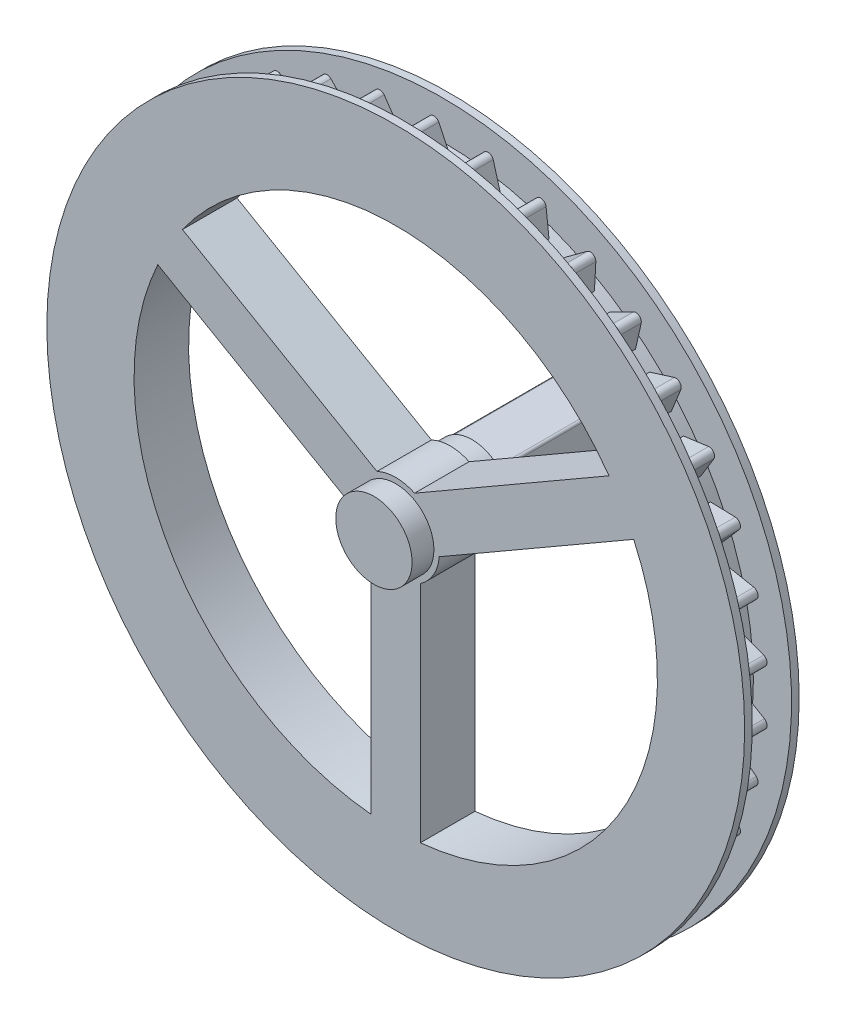
from build123d import *

# Parameters (mm, degrees)
SKETCH1_R                = 40
BOSS_EXTRUDE1_DEPTH      = 5
CUT_EXTRUDE1_DEPTH       = 5
SCALE1_SCALE             = 0.8
BOSS_EXTRUDE2_START      = 1
SKETCH4_R                = 32
BOSS_EXTRUDE2_DEPTH      = 1
SKETCH7_R                = 3.5
BOSS_EXTRUDE3_DEPTH      = 2
SKETCH9_W                = 4.9
SKETCH9_H                = 4.9
BOSS_EXTRUDE4_DEPTH      = 10
FILLET1_R                = 0.2
CUT_EXTRUDE2_DEPTH       = 1.8
CUT_EXTRUDE2_DEPTH_BACK  = 1.8
SKETCH10_R               = 32
SKETCH10_R_2             = 28.5
BOSS_EXTRUDE5_DEPTH      = 1
BOSS_EXTRUDE5_DEPTH_BACK = 1
CUT_EXTRUDE3_DEPTH       = 1
CUT_EXTRUDE3_DEPTH_BACK  = 1
SKETCH13_R               = 32
SKETCH13_R_2             = 28.5
BOSS_EXTRUDE6_DEPTH      = 1
BOSS_EXTRUDE6_DEPTH_BACK = 1


with BuildPart() as part:
    # Sketch1 → Boss-Extrude1 (new body)
    with BuildSketch(Plane.XY):
        Circle(SKETCH1_R)
    extrude(amount=BOSS_EXTRUDE1_DEPTH)

    # Sketch2 → Cut-Extrude1 (cut)
    with BuildSketch(Plane.XY.offset(5)):
        with BuildLine():
            Line((-2.158391272, 4.510138259), (-24.451826693, 17.381259201))
            ThreePointArc((-24.451826693, 17.381259201), (0, 30), (24.451826693, 17.381259201))
            Line((24.451826693, 17.381259201), (2.158391272, 4.510138259))
            ThreePointArc((2.158391272, 4.510138259), (0, 5), (-2.158391272, 4.510138259))
        make_face()
        with BuildLine():
            Line((4.985089943, -0.385847457), (27.278525364, 12.485273484))
            ThreePointArc((27.278525364, 12.485273484), (25.980762114, -15), (2.826698671, -29.866532685))
            Line((2.826698671, -29.866532685), (2.826698671, -4.124290802))
            ThreePointArc((2.826698671, -4.124290802), (4.330127019, -2.5), (4.985089943, -0.385847457))
        make_face()
        with BuildLine():
            Line((-2.826698671, -4.124290802), (-2.826698671, -29.866532685))
            ThreePointArc((-2.826698671, -29.866532685), (-25.980762114, -15), (-27.278525364, 12.485273484))
            Line((-27.278525364, 12.485273484), (-4.985089943, -0.385847457))
            ThreePointArc((-4.985089943, -0.385847457), (-4.330127019, -2.5), (-2.826698671, -4.124290802))
        make_face()
    extrude(amount=-CUT_EXTRUDE1_DEPTH, mode=Mode.SUBTRACT)


with BuildPart() as part_1:
    # Scale1: scaled about (0, 0, 2.5)
    add(part.part.scale(SCALE1_SCALE).moved(Location((0, 0, 0.5))))

    # Sketch4 → Boss-Extrude2 (add)
    with BuildSketch(Plane.XY.offset(4.5).offset(BOSS_EXTRUDE2_START)):
        Circle(SKETCH4_R)
        with BuildLine():
            Line((-2.261358937, -3.299432642), (-2.261358937, -23.893226148))
            ThreePointArc((-2.261358937, -23.893226148), (-20.784609691, -12), (-21.822820291, 9.988218787))
            Line((-21.822820291, 9.988218787), (-3.988071954, -0.308677966))
            ThreePointArc((-3.988071954, -0.308677966), (-3.464101615, -2), (-2.261358937, -3.299432642))
        make_face(mode=Mode.SUBTRACT)
        with BuildLine():
            Line((2.261358937, -23.893226148), (2.261358937, -3.299432642))
            ThreePointArc((2.261358937, -3.299432642), (3.464101615, -2), (3.988071954, -0.308677966))
            Line((3.988071954, -0.308677966), (21.822820291, 9.988218787))
            ThreePointArc((21.822820291, 9.988218787), (20.784609691, -12), (2.261358937, -23.893226148))
        make_face(mode=Mode.SUBTRACT)
        with BuildLine():
            Line((-1.726713017, 3.608110607), (-19.561461354, 13.905007361))
            ThreePointArc((-19.561461354, 13.905007361), (0, 24), (19.561461354, 13.905007361))
            Line((19.561461354, 13.905007361), (1.726713017, 3.608110607))
            ThreePointArc((1.726713017, 3.608110607), (0, 4), (-1.726713017, 3.608110607))
        make_face(mode=Mode.SUBTRACT)
    extrude(amount=-BOSS_EXTRUDE2_DEPTH)

    # Sketch7 → Boss-Extrude3 (add)
    with BuildSketch(Plane(origin=(0, 0, 0.5), x_dir=(-1, 0, 0), z_dir=(0, 0, -1))):
        Circle(SKETCH7_R)
    boss_extrude3 = extrude(amount=BOSS_EXTRUDE3_DEPTH)

    # Mirror1: Boss-Extrude3 across plane
    add(boss_extrude3.mirror(Plane.XY.offset(3)))

    # Sketch9 → Boss-Extrude4 (add)
    with BuildSketch(Plane(origin=(0, 0, -1.5), x_dir=(-1, 0, 0), z_dir=(0, 0, -1))):
        Rectangle(SKETCH9_W, SKETCH9_H)
    extrude(amount=BOSS_EXTRUDE4_DEPTH)

    # Fillet1
    fillet1_edges = [part_1.edges().sort_by_distance(p)[0] for p in [
        (-2.45, 0, -11.5),
        (0, 2.45, -11.5),
        (2.45, 0, -11.5),
        (0, -2.45, -11.5),
        (2.45, -2.45, -6.5),
        (-2.45, -2.45, -6.5),
        (2.45, 2.45, -6.5),
        (-2.45, 2.45, -6.5),
    ]]
    fillet(fillet1_edges, radius=FILLET1_R)

    # Sketch10 → Cut-Extrude2 (cut, two sides: drawn at the far end of the back side and taken through both)
    with BuildSketch(Plane(origin=(0, 0, 3), x_dir=(-1, 0, 0), z_dir=(0, 0, -1)).offset(-CUT_EXTRUDE2_DEPTH_BACK)):
        Circle(SKETCH10_R)
        Circle(SKETCH10_R_2, mode=Mode.SUBTRACT)
    extrude(amount=CUT_EXTRUDE2_DEPTH + CUT_EXTRUDE2_DEPTH_BACK, mode=Mode.SUBTRACT)

    # Sketch11 → Boss-Extrude5 (add, two sides: drawn at the far end of the back side and taken through both)
    with BuildSketch(Plane(origin=(0, 0, 3), x_dir=(-1, 0, 0), z_dir=(0, 0, -1)).offset(-BOSS_EXTRUDE5_DEPTH_BACK)):
        with BuildLine():
            ThreePointArc((2.855813009, 28.356557126), (0, 28.5), (-2.855813009, 28.356557126))
            add(Edge.make_bspline(
                [(-2.855813009, 28.356557126), (-0.347980272, 29.127168524), (-0.341401981, 31.604272994)],
                knots=[0, 0, 0, 1, 1, 1], degree=2))
            add(Edge.make_bspline(
                [(-0.341401981, 31.604272994), (-0.178982015, 31.68277435), (0, 31.688309846)],
                knots=[0, 0, 0, 1, 1, 1], degree=2))
            add(Edge.make_bspline(
                [(0.341401981, 31.604272994), (0.178982015, 31.68277435), (0, 31.688309846)],
                knots=[0, 0, 0, 1, 1, 1], degree=2))
            add(Edge.make_bspline(
                [(2.855813009, 28.356557126), (0.347980272, 29.127168524), (0.341401981, 31.604272994)],
                knots=[0, 0, 0, 1, 1, 1], degree=2))
        make_face()
        with BuildLine():
            ThreePointArc((8.505487333, 27.201225804), (5.737007823, 27.916603326), (2.910778636, 28.350967668))
            add(Edge.make_bspline(
                [(2.910778636, 28.350967668), (5.522398823, 28.600981587), (6.02747992, 31.026055383)],
                knots=[0, 0, 0, 1, 1, 1], degree=2))
            add(Edge.make_bspline(
                [(6.02747992, 31.026055383), (6.202377346, 31.070254913), (6.378809876, 31.039648282)],
                knots=[0, 0, 0, 1, 1, 1], degree=2))
            add(Edge.make_bspline(
                [(6.696306844, 30.888607956), (6.553013832, 30.998197283), (6.378809876, 31.039648282)],
                knots=[0, 0, 0, 1, 1, 1], degree=2))
            add(Edge.make_bspline(
                [(8.505487333, 27.201225804), (6.204113014, 28.46088576), (6.696306844, 30.888607956)],
                knots=[0, 0, 0, 1, 1, 1], degree=2))
        make_face()
        with BuildLine():
            ThreePointArc((13.806946006, 24.932273101), (11.239141871, 26.190297631), (8.558202661, 27.184686263))
            add(Edge.make_bspline(
                [(8.558202661, 27.184686263), (11.166690261, 26.903867103), (12.149596085, 29.177627418)],
                knots=[0, 0, 0, 1, 1, 1], degree=2))
            add(Edge.make_bspline(
                [(12.149596085, 29.177627418), (12.32981065, 29.185715588), (12.496470526, 29.12021987)],
                knots=[0, 0, 0, 1, 1, 1], degree=2))
            add(Edge.make_bspline(
                [(12.777064119, 28.908359678), (12.658764492, 29.044550377), (12.496470526, 29.12021987)],
                knots=[0, 0, 0, 1, 1, 1], degree=2))
            add(Edge.make_bspline(
                [(13.806946006, 24.932273101), (11.80624864, 26.629410988), (12.777064119, 28.908359678)],
                knots=[0, 0, 0, 1, 1, 1], degree=2))
        make_face()
        with BuildLine():
            ThreePointArc((18.543146688, 21.642590208), (16.28114413, 23.391758074), (13.855252863, 24.905460608))
            add(Edge.make_bspline(
                [(13.855252863, 24.905460608), (16.353816088, 24.105305139), (17.774306358, 26.134663959)],
                knots=[0, 0, 0, 1, 1, 1], degree=2))
            add(Edge.make_bspline(
                [(17.774306358, 26.134663959), (17.952460058, 26.106309639), (18.102524205, 26.008606235)],
                knots=[0, 0, 0, 1, 1, 1], degree=2))
            add(Edge.make_bspline(
                [(18.334726887, 25.744599759), (18.246263847, 25.901816166), (18.102524205, 26.008606235)],
                knots=[0, 0, 0, 1, 1, 1], degree=2))
            add(Edge.make_bspline(
                [(18.543146688, 21.642590208), (16.925035059, 23.707725002), (18.334726887, 25.744599759)],
                knots=[0, 0, 0, 1, 1, 1], degree=2))
        make_face()
        with BuildLine():
            ThreePointArc((22.520188766, 17.466857129), (20.656594436, 19.635557194), (18.585067386, 21.606602469))
            add(Edge.make_bspline(
                [(18.585067386, 21.606602469), (20.871414763, 20.319869151), (22.671334441, 22.021744287)],
                knots=[0, 0, 0, 1, 1, 1], degree=2))
            add(Edge.make_bspline(
                [(22.671334441, 22.021744287), (22.840133641, 21.958108305), (22.967458416, 21.832197205)],
                knots=[0, 0, 0, 1, 1, 1], degree=2))
            add(Edge.make_bspline(
                [(23.141763782, 21.526852901), (23.086759016, 21.698658558), (22.967458416, 21.832197205)],
                knots=[0, 0, 0, 1, 1, 1], degree=2))
            add(Edge.make_bspline(
                [(22.520188766, 17.466857129), (21.350908555, 19.815441968), (23.141763782, 21.526852901)],
                knots=[0, 0, 0, 1, 1, 1], degree=2))
        make_face()
        with BuildLine():
            ThreePointArc((25.575251669, 12.576028866), (24.186361339, 15.075474294), (22.554007066, 17.423167487))
            add(Edge.make_bspline(
                [(22.554007066, 17.423167487), (24.534535265, 15.702535332), (26.640195428, 17.007251817)],
                knots=[0, 0, 0, 1, 1, 1], degree=2))
            add(Edge.make_bspline(
                [(26.640195428, 17.007251817), (26.792729469, 16.910939438), (26.89210218, 16.761975457)],
                knots=[0, 0, 0, 1, 1, 1], degree=2))
            add(Edge.make_bspline(
                [(27.001374149, 16.427794156), (26.982079558, 16.607155319), (26.89210218, 16.761975457)],
                knots=[0, 0, 0, 1, 1, 1], degree=2))
            add(Edge.make_bspline(
                [(25.575251669, 12.576028866), (24.902673345, 15.111912413), (27.001374149, 16.427794156)],
                knots=[0, 0, 0, 1, 1, 1], degree=2))
        make_face()
        with BuildLine():
            ThreePointArc((27.583260765, 7.170336505), (26.725935766, 9.898199706), (25.599583047, 12.52642598))
            add(Edge.make_bspline(
                [(25.599583047, 12.52642598), (27.193209011, 10.442337871), (29.518403684, 11.296480458)],
                knots=[0, 0, 0, 1, 1, 1], degree=2))
            add(Edge.make_bspline(
                [(29.518403684, 11.296480458), (29.648427805, 11.171434723), (29.715780122, 11.005516463)],
                knots=[0, 0, 0, 1, 1, 1], degree=2))
            add(Edge.make_bspline(
                [(29.755545086, 10.656179588), (29.772750593, 10.83575319), (29.715780122, 11.005516463)],
                knots=[0, 0, 0, 1, 1, 1], degree=2))
            add(Edge.make_bspline(
                [(27.583260765, 7.170336505), (27.434919763, 9.789699387), (29.755545086, 10.656179588)],
                knots=[0, 0, 0, 1, 1, 1], degree=2))
        make_face()
        with BuildLine():
            ThreePointArc((28.462007923, 1.471089724), (28.171347243, 4.315691659), (27.59710909, 7.116851123))
            add(Edge.make_bspline(
                [(27.59710909, 7.116851123), (28.738589584, 4.754629871), (31.188125025, 5.123229863)],
                knots=[0, 0, 0, 1, 1, 1], degree=2))
            add(Edge.make_bspline(
                [(31.188125025, 5.123229863), (31.290316023, 4.974570158), (31.322890534, 4.798490333)],
                knots=[0, 0, 0, 1, 1, 1], degree=2))
            add(Edge.make_bspline(
                [(31.291520511, 4.448299775), (31.344521721, 4.620734052), (31.322890534, 4.798490333)],
                knots=[0, 0, 0, 1, 1, 1], degree=2))
            add(Edge.make_bspline(
                [(28.462007923, 1.471089724), (28.843977343, 4.066694918), (31.291520511, 4.448299775)],
                knots=[0, 0, 0, 1, 1, 1], degree=2))
        make_face()
        with BuildLine():
            ThreePointArc((28.175517133, -4.288383643), (28.463420454, -1.443501312), (28.464806244, 1.415911544))
            add(Edge.make_bspline(
                [(28.464806244, 1.415911544), (29.107408924, -1.127733235), (31.581000863, -1.259766365)],
                knots=[0, 0, 0, 1, 1, 1], degree=2))
            add(Edge.make_bspline(
                [(31.581000863, -1.259766365), (31.651175027, -1.425953894), (31.647638128, -1.604986556)],
                knots=[0, 0, 0, 1, 1, 1], degree=2))
            add(Edge.make_bspline(
                [(31.54641741, -1.941693952), (31.633044446, -1.78345848), (31.647638128, -1.604986556)],
                knots=[0, 0, 0, 1, 1, 1], degree=2))
            add(Edge.make_bspline(
                [(28.175517133, -4.288383643), (29.072159101, -1.822800518), (31.54641741, -1.941693952)],
                knots=[0, 0, 0, 1, 1, 1], degree=2))
        make_face()
        with BuildLine():
            ThreePointArc((26.735517362, -9.872290079), (27.590197888, -7.143597169), (28.167150886, -4.34299562))
            add(Edge.make_bspline(
                [(28.167150886, -4.34299562), (28.284567522, -6.963926809), (30.680946815, -7.59118761)],
                knots=[0, 0, 0, 1, 1, 1], degree=2))
            add(Edge.make_bspline(
                [(30.680946815, -7.59118761), (30.716231206, -7.768099226), (30.676727697, -7.942755106)],
                knots=[0, 0, 0, 1, 1, 1], degree=2))
            add(Edge.make_bspline(
                [(30.509800273, -8.252194502), (30.626506615, -8.114636013), (30.676727697, -7.942755106)],
                knots=[0, 0, 0, 1, 1, 1], degree=2))
            add(Edge.make_bspline(
                [(26.735517362, -9.872290079), (28.110123249, -7.637670287), (30.509800273, -8.252194502)],
                knots=[0, 0, 0, 1, 1, 1], degree=2))
        make_face()
        with BuildLine():
            ThreePointArc((24.200962368, -15.0520238), (25.587429378, -12.551233319), (26.716329062, -9.924100033))
            add(Edge.make_bspline(
                [(26.716329062, -9.924100033), (26.303752603, -12.515016402), (28.524811199, -13.611824743)],
                knots=[0, 0, 0, 1, 1, 1], degree=2))
            add(Edge.make_bspline(
                [(28.524811199, -13.611824743), (28.52376127, -13.792217663), (28.449908431, -13.955346329)],
                knots=[0, 0, 0, 1, 1, 1], degree=2))
            add(Edge.make_bspline(
                [(28.224108328, -14.224849239), (28.366116005, -14.113599395), (28.449908431, -13.955346329)],
                knots=[0, 0, 0, 1, 1, 1], degree=2))
            add(Edge.make_bspline(
                [(24.200962368, -15.0520238), (25.997255649, -13.139852937), (28.224108328, -14.224849239)],
                knots=[0, 0, 0, 1, 1, 1], degree=2))
        make_face()
        with BuildLine():
            ThreePointArc((20.675617131, -19.615525898), (22.537108503, -17.445020503), (24.171737586, -15.098910625))
            add(Edge.make_bspline(
                [(24.171737586, -15.098910625), (23.246058961, -17.553739752), (25.200866462, -19.075192171)],
                knots=[0, 0, 0, 1, 1, 1], degree=2))
            add(Edge.make_bspline(
                [(25.200866462, -19.075192171), (25.163525197, -19.251681088), (25.058346571, -19.396604034)],
                knots=[0, 0, 0, 1, 1, 1], degree=2))
            add(Edge.make_bspline(
                [(24.782918072, -19.615136976), (24.944413273, -19.534750358), (25.058346571, -19.396604034)],
                knots=[0, 0, 0, 1, 1, 1], degree=2))
            add(Edge.make_bspline(
                [(20.675617131, -19.615525898), (22.820057348, -18.104088464), (24.782918072, -19.615136976)],
                knots=[0, 0, 0, 1, 1, 1], degree=2))
        make_face()
        with BuildLine():
            ThreePointArc((16.3038097, -23.375966061), (18.564115758, -21.624606497), (20.637552334, -19.655570042))
            add(Edge.make_bspline(
                [(20.637552334, -19.655570042), (19.236668934, -21.873810935), (20.845195291, -23.75761899)],
                knots=[0, 0, 0, 1, 1, 1], degree=2))
            add(Edge.make_bspline(
                [(20.845195291, -23.75761899), (20.773091446, -23.922978428), (20.640893058, -24.04376249)],
                knots=[0, 0, 0, 1, 1, 1], degree=2))
            add(Edge.make_bspline(
                [(20.327112239, -24.202378702), (20.50148333, -24.156146347), (20.640893058, -24.04376249)],
                knots=[0, 0, 0, 1, 1, 1], degree=2))
            add(Edge.make_bspline(
                [(16.3038097, -23.375966061), (18.708603218, -22.327140483), (20.327112239, -24.202378702)],
                knots=[0, 0, 0, 1, 1, 1], degree=2))
        make_face()
        with BuildLine():
            ThreePointArc((11.264522384, -26.179391427), (13.831105932, -24.91887856), (16.258463264, -23.407528111))
            add(Edge.make_bspline(
                [(16.258463264, -23.407528111), (14.439727421, -25.298365728), (15.636119375, -27.467406097)],
                knots=[0, 0, 0, 1, 1, 1], degree=2))
            add(Edge.make_bspline(
                [(15.636119375, -27.467406097), (15.53220489, -27.61486622), (15.378398958, -27.706566485)],
                knots=[0, 0, 0, 1, 1, 1], degree=2))
            add(Edge.make_bspline(
                [(15.039112042, -27.798772199), (15.219220251, -27.788586866), (15.378398958, -27.706566485)],
                knots=[0, 0, 0, 1, 1, 1], degree=2))
            add(Edge.make_bspline(
                [(11.264522384, -26.179391427), (13.831216675, -25.636116746), (15.039112042, -27.798772199)],
                knots=[0, 0, 0, 1, 1, 1], degree=2))
        make_face()
        with BuildLine():
            ThreePointArc((5.764064198, -27.911029431), (8.531849005, -27.192968807), (11.213750799, -26.20117923))
            add(Edge.make_bspline(
                [(11.213750799, -26.20117923), (9.051621771, -27.687202456), (9.786898895, -30.05267437)],
                knots=[0, 0, 0, 1, 1, 1], degree=2))
            add(Edge.make_bspline(
                [(9.786898895, -30.05267437), (9.655428041, -30.176198144), (9.486311397, -30.235060393)],
                knots=[0, 0, 0, 1, 1, 1], degree=2))
            add(Edge.make_bspline(
                [(9.135408831, -30.257080697), (9.313880507, -30.283359374), (9.486311397, -30.235060393)],
                knots=[0, 0, 0, 1, 1, 1], degree=2))
            add(Edge.make_bspline(
                [(5.764064198, -27.911029431), (8.387578495, -27.895547378), (9.135408831, -30.257080697)],
                knots=[0, 0, 0, 1, 1, 1], degree=2))
        make_face()
        with BuildLine():
            ThreePointArc((0.027624546, -28.499986612), (2.883297177, -28.353775717), (5.709946057, -27.922150992))
            add(Edge.make_bspline(
                [(5.709946057, -27.922150992), (3.292941662, -28.942521862), (3.537001624, -31.407582624)],
                knots=[0, 0, 0, 1, 1, 1], degree=2))
            add(Edge.make_bspline(
                [(3.537001624, -31.407582624), (3.383356833, -31.502112971), (3.205853134, -31.525727376)],
                knots=[0, 0, 0, 1, 1, 1], degree=2))
            add(Edge.make_bspline(
                [(2.857700909, -31.476660755), (3.027229401, -31.538327591), (3.205853134, -31.525727376)],
                knots=[0, 0, 0, 1, 1, 1], degree=2))
            add(Edge.make_bspline(
                [(0.027624546, -28.499986612), (2.600551866, -29.012931022), (2.857700909, -31.476660755)],
                knots=[0, 0, 0, 1, 1, 1], degree=2))
        make_face()
        with BuildLine():
            ThreePointArc((-5.709946057, -27.922150992), (-2.883297177, -28.353775717), (-0.027624546, -28.499986612))
            add(Edge.make_bspline(
                [(-0.027624546, -28.499986612), (-2.600551866, -29.012931022), (-2.857700909, -31.476660755)],
                knots=[0, 0, 0, 1, 1, 1], degree=2))
            add(Edge.make_bspline(
                [(-2.857700909, -31.476660755), (-3.027229401, -31.538327591), (-3.205853134, -31.525727376)],
                knots=[0, 0, 0, 1, 1, 1], degree=2))
            add(Edge.make_bspline(
                [(-3.537001624, -31.407582624), (-3.383356833, -31.502112971), (-3.205853134, -31.525727376)],
                knots=[0, 0, 0, 1, 1, 1], degree=2))
            add(Edge.make_bspline(
                [(-5.709946057, -27.922150992), (-3.292941662, -28.942521862), (-3.537001624, -31.407582624)],
                knots=[0, 0, 0, 1, 1, 1], degree=2))
        make_face()
        with BuildLine():
            ThreePointArc((-11.213750799, -26.20117923), (-8.531849005, -27.192968807), (-5.764064198, -27.911029431))
            add(Edge.make_bspline(
                [(-5.764064198, -27.911029431), (-8.387578495, -27.895547378), (-9.135408831, -30.257080697)],
                knots=[0, 0, 0, 1, 1, 1], degree=2))
            add(Edge.make_bspline(
                [(-9.135408831, -30.257080697), (-9.313880507, -30.283359374), (-9.486311397, -30.235060393)],
                knots=[0, 0, 0, 1, 1, 1], degree=2))
            add(Edge.make_bspline(
                [(-9.786898895, -30.05267437), (-9.655428041, -30.176198144), (-9.486311397, -30.235060393)],
                knots=[0, 0, 0, 1, 1, 1], degree=2))
            add(Edge.make_bspline(
                [(-11.213750799, -26.20117923), (-9.051621771, -27.687202456), (-9.786898895, -30.05267437)],
                knots=[0, 0, 0, 1, 1, 1], degree=2))
        make_face()
        with BuildLine():
            ThreePointArc((-16.258463264, -23.407528111), (-13.831105932, -24.91887856), (-11.264522384, -26.179391427))
            add(Edge.make_bspline(
                [(-11.264522384, -26.179391427), (-13.831216675, -25.636116746), (-15.039112042, -27.798772199)],
                knots=[0, 0, 0, 1, 1, 1], degree=2))
            add(Edge.make_bspline(
                [(-15.039112042, -27.798772199), (-15.219220251, -27.788586866), (-15.378398958, -27.706566485)],
                knots=[0, 0, 0, 1, 1, 1], degree=2))
            add(Edge.make_bspline(
                [(-15.636119375, -27.467406097), (-15.53220489, -27.61486622), (-15.378398958, -27.706566485)],
                knots=[0, 0, 0, 1, 1, 1], degree=2))
            add(Edge.make_bspline(
                [(-16.258463264, -23.407528111), (-14.439727421, -25.298365728), (-15.636119375, -27.467406097)],
                knots=[0, 0, 0, 1, 1, 1], degree=2))
        make_face()
        with BuildLine():
            ThreePointArc((-20.637552334, -19.655570042), (-18.564115758, -21.624606497), (-16.3038097, -23.375966061))
            add(Edge.make_bspline(
                [(-16.3038097, -23.375966061), (-18.708603218, -22.327140482), (-20.327112239, -24.202378702)],
                knots=[0, 0, 0, 1, 1, 1], degree=2))
            add(Edge.make_bspline(
                [(-20.327112239, -24.202378702), (-20.50148333, -24.156146347), (-20.640893058, -24.04376249)],
                knots=[0, 0, 0, 1, 1, 1], degree=2))
            add(Edge.make_bspline(
                [(-20.845195291, -23.75761899), (-20.773091446, -23.922978428), (-20.640893058, -24.04376249)],
                knots=[0, 0, 0, 1, 1, 1], degree=2))
            add(Edge.make_bspline(
                [(-20.637552334, -19.655570042), (-19.236668934, -21.873810935), (-20.845195291, -23.75761899)],
                knots=[0, 0, 0, 1, 1, 1], degree=2))
        make_face()
        with BuildLine():
            ThreePointArc((-24.171737586, -15.098910625), (-22.537108503, -17.445020503), (-20.675617131, -19.615525898))
            add(Edge.make_bspline(
                [(-20.675617131, -19.615525898), (-22.820057348, -18.104088464), (-24.782918072, -19.615136976)],
                knots=[0, 0, 0, 1, 1, 1], degree=2))
            add(Edge.make_bspline(
                [(-24.782918072, -19.615136976), (-24.944413273, -19.534750358), (-25.058346571, -19.396604034)],
                knots=[0, 0, 0, 1, 1, 1], degree=2))
            add(Edge.make_bspline(
                [(-25.200866462, -19.075192171), (-25.163525197, -19.251681088), (-25.058346571, -19.396604034)],
                knots=[0, 0, 0, 1, 1, 1], degree=2))
            add(Edge.make_bspline(
                [(-24.171737586, -15.098910625), (-23.246058961, -17.553739752), (-25.200866462, -19.075192171)],
                knots=[0, 0, 0, 1, 1, 1], degree=2))
        make_face()
        with BuildLine():
            ThreePointArc((-26.716329062, -9.924100033), (-25.587429378, -12.551233319), (-24.200962368, -15.0520238))
            add(Edge.make_bspline(
                [(-24.200962368, -15.0520238), (-25.997255649, -13.139852937), (-28.224108328, -14.224849239)],
                knots=[0, 0, 0, 1, 1, 1], degree=2))
            add(Edge.make_bspline(
                [(-28.224108328, -14.224849239), (-28.366116005, -14.113599395), (-28.449908431, -13.955346329)],
                knots=[0, 0, 0, 1, 1, 1], degree=2))
            add(Edge.make_bspline(
                [(-28.524811199, -13.611824743), (-28.52376127, -13.792217663), (-28.449908431, -13.955346329)],
                knots=[0, 0, 0, 1, 1, 1], degree=2))
            add(Edge.make_bspline(
                [(-26.716329062, -9.924100033), (-26.303752603, -12.515016402), (-28.524811199, -13.611824743)],
                knots=[0, 0, 0, 1, 1, 1], degree=2))
        make_face()
        with BuildLine():
            ThreePointArc((-28.167150886, -4.34299562), (-27.590197888, -7.143597169), (-26.735517362, -9.872290079))
            add(Edge.make_bspline(
                [(-26.735517362, -9.872290079), (-28.110123249, -7.637670287), (-30.509800273, -8.252194502)],
                knots=[0, 0, 0, 1, 1, 1], degree=2))
            add(Edge.make_bspline(
                [(-30.509800273, -8.252194502), (-30.626506615, -8.114636013), (-30.676727697, -7.942755106)],
                knots=[0, 0, 0, 1, 1, 1], degree=2))
            add(Edge.make_bspline(
                [(-30.680946815, -7.59118761), (-30.716231206, -7.768099226), (-30.676727697, -7.942755106)],
                knots=[0, 0, 0, 1, 1, 1], degree=2))
            add(Edge.make_bspline(
                [(-28.167150886, -4.34299562), (-28.284567522, -6.963926809), (-30.680946815, -7.59118761)],
                knots=[0, 0, 0, 1, 1, 1], degree=2))
        make_face()
        with BuildLine():
            ThreePointArc((-28.464806244, 1.415911544), (-28.463420454, -1.443501312), (-28.175517133, -4.288383643))
            add(Edge.make_bspline(
                [(-28.175517133, -4.288383643), (-29.072159101, -1.822800518), (-31.54641741, -1.941693952)],
                knots=[0, 0, 0, 1, 1, 1], degree=2))
            add(Edge.make_bspline(
                [(-31.54641741, -1.941693952), (-31.633044446, -1.78345848), (-31.647638128, -1.604986556)],
                knots=[0, 0, 0, 1, 1, 1], degree=2))
            add(Edge.make_bspline(
                [(-31.581000863, -1.259766365), (-31.651175027, -1.425953894), (-31.647638128, -1.604986556)],
                knots=[0, 0, 0, 1, 1, 1], degree=2))
            add(Edge.make_bspline(
                [(-28.464806244, 1.415911544), (-29.107408924, -1.127733235), (-31.581000863, -1.259766365)],
                knots=[0, 0, 0, 1, 1, 1], degree=2))
        make_face()
        with BuildLine():
            ThreePointArc((-27.59710909, 7.116851123), (-28.171347243, 4.315691659), (-28.462007923, 1.471089724))
            add(Edge.make_bspline(
                [(-28.462007923, 1.471089724), (-28.843977343, 4.066694918), (-31.291520511, 4.448299775)],
                knots=[0, 0, 0, 1, 1, 1], degree=2))
            add(Edge.make_bspline(
                [(-31.291520511, 4.448299775), (-31.344521721, 4.620734052), (-31.322890534, 4.798490333)],
                knots=[0, 0, 0, 1, 1, 1], degree=2))
            add(Edge.make_bspline(
                [(-31.188125025, 5.123229863), (-31.290316023, 4.974570158), (-31.322890534, 4.798490333)],
                knots=[0, 0, 0, 1, 1, 1], degree=2))
            add(Edge.make_bspline(
                [(-27.59710909, 7.116851123), (-28.738589584, 4.754629871), (-31.188125025, 5.123229863)],
                knots=[0, 0, 0, 1, 1, 1], degree=2))
        make_face()
        with BuildLine():
            ThreePointArc((-25.599583047, 12.52642598), (-26.725935766, 9.898199706), (-27.583260765, 7.170336505))
            add(Edge.make_bspline(
                [(-27.583260765, 7.170336505), (-27.434919763, 9.789699387), (-29.755545086, 10.656179588)],
                knots=[0, 0, 0, 1, 1, 1], degree=2))
            add(Edge.make_bspline(
                [(-29.755545086, 10.656179588), (-29.772750593, 10.83575319), (-29.715780122, 11.005516463)],
                knots=[0, 0, 0, 1, 1, 1], degree=2))
            add(Edge.make_bspline(
                [(-29.518403684, 11.296480458), (-29.648427805, 11.171434723), (-29.715780122, 11.005516463)],
                knots=[0, 0, 0, 1, 1, 1], degree=2))
            add(Edge.make_bspline(
                [(-25.599583047, 12.52642598), (-27.193209011, 10.442337871), (-29.518403684, 11.296480458)],
                knots=[0, 0, 0, 1, 1, 1], degree=2))
        make_face()
        with BuildLine():
            ThreePointArc((-22.554007066, 17.423167487), (-24.186361339, 15.075474294), (-25.575251669, 12.576028866))
            add(Edge.make_bspline(
                [(-25.575251669, 12.576028866), (-24.902673345, 15.111912413), (-27.001374149, 16.427794156)],
                knots=[0, 0, 0, 1, 1, 1], degree=2))
            add(Edge.make_bspline(
                [(-27.001374149, 16.427794156), (-26.982079558, 16.607155319), (-26.89210218, 16.761975457)],
                knots=[0, 0, 0, 1, 1, 1], degree=2))
            add(Edge.make_bspline(
                [(-26.640195428, 17.007251817), (-26.792729469, 16.910939438), (-26.89210218, 16.761975457)],
                knots=[0, 0, 0, 1, 1, 1], degree=2))
            add(Edge.make_bspline(
                [(-22.554007066, 17.423167487), (-24.534535265, 15.702535332), (-26.640195428, 17.007251817)],
                knots=[0, 0, 0, 1, 1, 1], degree=2))
        make_face()
        with BuildLine():
            ThreePointArc((-18.585067386, 21.606602469), (-20.656594436, 19.635557194), (-22.520188766, 17.466857129))
            add(Edge.make_bspline(
                [(-22.520188766, 17.466857129), (-21.350908555, 19.815441968), (-23.141763782, 21.526852901)],
                knots=[0, 0, 0, 1, 1, 1], degree=2))
            add(Edge.make_bspline(
                [(-23.141763782, 21.526852901), (-23.086759016, 21.698658558), (-22.967458416, 21.832197205)],
                knots=[0, 0, 0, 1, 1, 1], degree=2))
            add(Edge.make_bspline(
                [(-22.671334441, 22.021744287), (-22.840133641, 21.958108305), (-22.967458416, 21.832197205)],
                knots=[0, 0, 0, 1, 1, 1], degree=2))
            add(Edge.make_bspline(
                [(-18.585067386, 21.606602469), (-20.871414763, 20.319869151), (-22.671334441, 22.021744287)],
                knots=[0, 0, 0, 1, 1, 1], degree=2))
        make_face()
        with BuildLine():
            ThreePointArc((-13.855252863, 24.905460608), (-16.28114413, 23.391758074), (-18.543146688, 21.642590208))
            add(Edge.make_bspline(
                [(-18.543146688, 21.642590208), (-16.925035059, 23.707725002), (-18.334726887, 25.744599759)],
                knots=[0, 0, 0, 1, 1, 1], degree=2))
            add(Edge.make_bspline(
                [(-18.334726887, 25.744599759), (-18.246263847, 25.901816166), (-18.102524205, 26.008606235)],
                knots=[0, 0, 0, 1, 1, 1], degree=2))
            add(Edge.make_bspline(
                [(-17.774306358, 26.134663959), (-17.952460058, 26.106309639), (-18.102524205, 26.008606235)],
                knots=[0, 0, 0, 1, 1, 1], degree=2))
            add(Edge.make_bspline(
                [(-13.855252863, 24.905460608), (-16.353816088, 24.105305139), (-17.774306358, 26.134663959)],
                knots=[0, 0, 0, 1, 1, 1], degree=2))
        make_face()
        with BuildLine():
            ThreePointArc((-8.558202661, 27.184686263), (-11.239141871, 26.190297631), (-13.806946006, 24.932273101))
            add(Edge.make_bspline(
                [(-13.806946006, 24.932273101), (-11.80624864, 26.629410988), (-12.777064119, 28.908359678)],
                knots=[0, 0, 0, 1, 1, 1], degree=2))
            add(Edge.make_bspline(
                [(-12.777064119, 28.908359678), (-12.658764492, 29.044550377), (-12.496470526, 29.12021987)],
                knots=[0, 0, 0, 1, 1, 1], degree=2))
            add(Edge.make_bspline(
                [(-12.149596085, 29.177627418), (-12.32981065, 29.185715588), (-12.496470526, 29.12021987)],
                knots=[0, 0, 0, 1, 1, 1], degree=2))
            add(Edge.make_bspline(
                [(-8.558202661, 27.184686263), (-11.166690261, 26.903867103), (-12.149596085, 29.177627418)],
                knots=[0, 0, 0, 1, 1, 1], degree=2))
        make_face()
        with BuildLine():
            ThreePointArc((-2.910778636, 28.350967668), (-5.737007823, 27.916603326), (-8.505487333, 27.201225804))
            add(Edge.make_bspline(
                [(-8.505487333, 27.201225804), (-6.204113014, 28.46088576), (-6.696306844, 30.888607956)],
                knots=[0, 0, 0, 1, 1, 1], degree=2))
            add(Edge.make_bspline(
                [(-6.696306844, 30.888607956), (-6.553013832, 30.998197283), (-6.378809876, 31.039648282)],
                knots=[0, 0, 0, 1, 1, 1], degree=2))
            add(Edge.make_bspline(
                [(-6.02747992, 31.026055383), (-6.202377346, 31.070254913), (-6.378809876, 31.039648282)],
                knots=[0, 0, 0, 1, 1, 1], degree=2))
            add(Edge.make_bspline(
                [(-2.910778636, 28.350967668), (-5.522398823, 28.600981587), (-6.02747992, 31.026055383)],
                knots=[0, 0, 0, 1, 1, 1], degree=2))
        make_face()
    extrude(amount=BOSS_EXTRUDE5_DEPTH + BOSS_EXTRUDE5_DEPTH_BACK)

    # Sketch13 → Cut-Extrude3 (cut, two sides: drawn at the far end of the back side and taken through both)
    with BuildSketch(Plane(origin=(0, 0, 3), x_dir=(-1, 0, 0), z_dir=(0, 0, -1)).offset(-CUT_EXTRUDE3_DEPTH_BACK)):
        Circle(SKETCH13_R)
        Circle(SKETCH13_R_2, mode=Mode.SUBTRACT)
    extrude(amount=CUT_EXTRUDE3_DEPTH + CUT_EXTRUDE3_DEPTH_BACK, mode=Mode.SUBTRACT)

    # Sketch14 → Boss-Extrude6 (add, two sides: drawn at the far end of the back side and taken through both)
    with BuildSketch(Plane(origin=(0, 0, 3), x_dir=(-1, 0, 0), z_dir=(0, 0, -1)).offset(-BOSS_EXTRUDE6_DEPTH_BACK)):
        with BuildLine():
            Line((-1.5, 28.460498942), (1.5, 28.460498942))
            Line((1.5, 28.460498942), (0.443661636, 30.691072905))
            ThreePointArc((0.443661636, 30.691072905), (0, 30.960498942), (-0.443661636, 30.691072905))
            Line((-0.443661636, 30.691072905), (-1.5, 28.460498942))
        make_face()
        with BuildLine():
            Line((3.154330258, 28.323417228), (6.113414169, 27.829633457))
            Line((6.113414169, 27.829633457), (5.438623291, 30.203652879))
            ThreePointArc((5.438623291, 30.203652879), (5.045358689, 30.542428601), (4.563401951, 30.34970149))
            Line((4.563401951, 30.34970149), (3.154330258, 28.323417228))
        make_face()
        with BuildLine():
            Line((7.72261861, 27.422127549), (10.560070335, 26.448029141))
            Line((10.560070335, 26.448029141), (10.28523348, 28.90073696))
            ThreePointArc((10.28523348, 28.90073696), (9.953093146, 29.299621449), (9.445987829, 29.188850356))
            Line((9.445987829, 29.188850356), (7.72261861, 27.422127549))
        make_face()
        with BuildLine():
            Line((12.080254057, 25.781214736), (14.718675311, 24.353372557))
            Line((14.718675311, 24.353372557), (14.85128931, 26.817865298))
            ThreePointArc((14.85128931, 26.817865298), (14.589333167, 27.265978024), (14.070911783, 27.240184496))
            Line((14.070911783, 27.240184496), (12.080254057, 25.781214736))
        make_face()
        with BuildLine():
            Line((16.108371665, 23.445438614), (18.475793193, 21.602800476))
            Line((18.475793193, 21.602800476), (19.012240683, 24.011853202))
            ThreePointArc((19.012240683, 24.011853202), (18.827614211, 24.496970819), (18.312017944, 24.556858436))
            Line((18.312017944, 24.556858436), (16.108371665, 23.445438614))
        make_face()
        with BuildLine():
            Line((19.697094885, 20.478513067), (21.7289396, 18.271341335))
            Line((21.7289396, 18.271341335), (22.654587692, 20.559241367))
            ThreePointArc((22.654587692, 20.559241367), (22.552327019, 21.06813113), (22.053619991, 21.212066315))
            Line((22.053619991, 21.212066315), (19.697094885, 20.478513067))
        make_face()
        with BuildLine():
            Line((22.748532703, 16.96136809), (24.389377177, 14.449868655))
            Line((24.389377177, 14.449868655), (25.678976604, 16.554208044))
            ThreePointArc((25.678976604, 16.554208044), (25.661871136, 17.072988768), (25.193656774, 17.297045343))
            Line((25.193656774, 17.297045343), (22.748532703, 16.96136809))
        make_face()
        with BuildLine():
            Line((25.17944985, 12.989942228), (26.384536124, 10.242622248))
            Line((26.384536124, 10.242622248), (28.002909975, 12.106000101))
            ThreePointArc((28.002909975, 12.106000101), (28.071426303, 12.6205208), (27.646476276, 12.918587086))
            Line((27.646476276, 12.918587086), (25.17944985, 12.989942228))
        make_face()
        with BuildLine():
            Line((26.923537242, 8.672565627), (27.659993704, 5.764364829))
            Line((27.659993704, 5.764364829), (29.562996959, 7.335953056))
            ThreePointArc((29.562996959, 7.335953056), (29.715266138, 7.832178946), (29.345171973, 8.196124472))
            Line((29.345171973, 8.196124472), (26.923537242, 8.672565627))
        make_face()
        with BuildLine():
            Line((27.933220724, 4.127005065), (28.18095876, 1.137251586))
            Line((28.18095876, 1.137251586), (30.316682452, 2.374181357))
            ThreePointArc((30.316682452, 2.374181357), (30.548550974, 2.83857669), (30.243407877, 3.258473971))
            Line((30.243407877, 3.258473971), (27.933220724, 4.127005065))
        make_face()
        with BuildLine():
            Line((28.18095876, -0.522748414), (27.933220724, -3.512501893))
            Line((27.933220724, -3.512501893), (30.243407877, -2.643970798))
            ThreePointArc((30.243407877, -2.643970798), (30.548550974, -2.224073517), (30.316682452, -1.759678184))
            Line((30.316682452, -1.759678184), (28.18095876, -0.522748414))
        make_face()
        with BuildLine():
            Line((27.659993704, -5.149861656), (26.923537242, -8.058062454))
            Line((26.923537242, -8.058062454), (29.345171973, -7.581621299))
            ThreePointArc((29.345171973, -7.581621299), (29.715266138, -7.217675773), (29.562996959, -6.721449883))
            Line((29.562996959, -6.721449883), (27.659993704, -5.149861656))
        make_face()
        with BuildLine():
            Line((26.384536124, -9.628119075), (25.17944985, -12.375439055))
            Line((25.17944985, -12.375439055), (27.646476276, -12.304083913))
            ThreePointArc((27.646476276, -12.304083913), (28.071426303, -12.006017627), (28.002909975, -11.491496928))
            Line((28.002909975, -11.491496928), (26.384536124, -9.628119075))
        make_face()
        with BuildLine():
            Line((24.389377177, -13.835365482), (22.748532703, -16.346864917))
            Line((22.748532703, -16.346864917), (25.193656774, -16.68254217))
            ThreePointArc((25.193656774, -16.68254217), (25.661871136, -16.458485595), (25.678976604, -15.939704871))
            Line((25.678976604, -15.939704871), (24.389377177, -13.835365482))
        make_face()
        with BuildLine():
            Line((21.7289396, -17.656838163), (19.697094885, -19.864009895))
            Line((19.697094885, -19.864009895), (22.053619991, -20.597563142))
            ThreePointArc((22.053619991, -20.597563142), (22.552327019, -20.453627958), (22.654587692, -19.944738194))
            Line((22.654587692, -19.944738194), (21.7289396, -17.656838163))
        make_face()
        with BuildLine():
            Line((18.475793193, -20.988297304), (16.108371665, -22.830935442))
            Line((16.108371665, -22.830935442), (18.312017944, -23.942355263))
            ThreePointArc((18.312017944, -23.942355263), (18.827614211, -23.882467646), (19.012240683, -23.397350029))
            Line((19.012240683, -23.397350029), (18.475793193, -20.988297304))
        make_face()
        with BuildLine():
            Line((14.718675311, -23.738869384), (12.080254057, -25.166711563))
            Line((12.080254057, -25.166711563), (14.070911783, -26.625681324))
            ThreePointArc((14.070911783, -26.625681324), (14.589333167, -26.651474852), (14.85128931, -26.203362125))
            Line((14.85128931, -26.203362125), (14.718675311, -23.738869384))
        make_face()
        with BuildLine():
            Line((10.560070335, -25.833525968), (7.72261861, -26.807624376))
            Line((7.72261861, -26.807624376), (9.445987829, -28.574347183))
            ThreePointArc((9.445987829, -28.574347183), (9.953093146, -28.685118276), (10.285233479, -28.286233788))
            Line((10.285233479, -28.286233788), (10.560070335, -25.833525968))
        make_face()
        with BuildLine():
            Line((6.113414169, -27.215130285), (3.154330258, -27.708914055))
            Line((3.154330258, -27.708914055), (4.563401951, -29.735198317))
            ThreePointArc((4.563401951, -29.735198317), (5.045358689, -29.927925428), (5.438623291, -29.589149706))
            Line((5.438623291, -29.589149706), (6.113414169, -27.215130285))
        make_face()
        with BuildLine():
            Line((1.5, -27.845995769), (-1.5, -27.845995769))
            Line((-1.5, -27.845995769), (-0.443661636, -30.076569732))
            ThreePointArc((-0.443661636, -30.076569732), (0, -30.345995769), (0.443661636, -30.076569732))
            Line((0.443661636, -30.076569732), (1.5, -27.845995769))
        make_face()
        with BuildLine():
            Line((-3.154330258, -27.708914055), (-6.113414169, -27.215130284))
            Line((-6.113414169, -27.215130284), (-5.438623291, -29.589149706))
            ThreePointArc((-5.438623291, -29.589149706), (-5.045358689, -29.927925428), (-4.563401951, -29.735198317))
            Line((-4.563401951, -29.735198317), (-3.154330258, -27.708914055))
        make_face()
        with BuildLine():
            Line((-7.72261861, -26.807624376), (-10.560070335, -25.833525968))
            Line((-10.560070335, -25.833525968), (-10.28523348, -28.286233787))
            ThreePointArc((-10.28523348, -28.286233787), (-9.953093146, -28.685118276), (-9.445987829, -28.574347183))
            Line((-9.445987829, -28.574347183), (-7.72261861, -26.807624376))
        make_face()
        with BuildLine():
            Line((-12.080254057, -25.166711563), (-14.718675311, -23.738869384))
            Line((-14.718675311, -23.738869384), (-14.851289311, -26.203362125))
            ThreePointArc((-14.851289311, -26.203362125), (-14.589333167, -26.651474852), (-14.070911784, -26.625681324))
            Line((-14.070911784, -26.625681324), (-12.080254057, -25.166711563))
        make_face()
        with BuildLine():
            Line((-16.108371665, -22.830935442), (-18.475793193, -20.988297304))
            Line((-18.475793193, -20.988297304), (-19.012240684, -23.397350029))
            ThreePointArc((-19.012240684, -23.397350029), (-18.827614211, -23.882467646), (-18.312017944, -23.942355263))
            Line((-18.312017944, -23.942355263), (-16.108371665, -22.830935442))
        make_face()
        with BuildLine():
            Line((-19.697094885, -19.864009895), (-21.7289396, -17.656838163))
            Line((-21.7289396, -17.656838163), (-22.654587692, -19.944738194))
            ThreePointArc((-22.654587692, -19.944738194), (-22.552327019, -20.453627958), (-22.053619991, -20.597563142))
            Line((-22.053619991, -20.597563142), (-19.697094885, -19.864009895))
        make_face()
        with BuildLine():
            Line((-22.748532703, -16.346864917), (-24.389377177, -13.835365482))
            Line((-24.389377177, -13.835365482), (-25.678976604, -15.939704871))
            ThreePointArc((-25.678976604, -15.939704871), (-25.661871136, -16.458485595), (-25.193656774, -16.68254217))
            Line((-25.193656774, -16.68254217), (-22.748532703, -16.346864917))
        make_face()
        with BuildLine():
            Line((-25.17944985, -12.375439055), (-26.384536124, -9.628119075))
            Line((-26.384536124, -9.628119075), (-28.002909975, -11.491496928))
            ThreePointArc((-28.002909975, -11.491496928), (-28.071426303, -12.006017627), (-27.646476276, -12.304083913))
            Line((-27.646476276, -12.304083913), (-25.17944985, -12.375439055))
        make_face()
        with BuildLine():
            Line((-26.923537242, -8.058062454), (-27.659993704, -5.149861656))
            Line((-27.659993704, -5.149861656), (-29.562996959, -6.721449883))
            ThreePointArc((-29.562996959, -6.721449883), (-29.715266138, -7.217675773), (-29.345171973, -7.581621299))
            Line((-29.345171973, -7.581621299), (-26.923537242, -8.058062454))
        make_face()
        with BuildLine():
            Line((-27.933220724, -3.512501893), (-28.18095876, -0.522748414))
            Line((-28.18095876, -0.522748414), (-30.316682452, -1.759678184))
            ThreePointArc((-30.316682452, -1.759678184), (-30.548550974, -2.224073517), (-30.243407877, -2.643970798))
            Line((-30.243407877, -2.643970798), (-27.933220724, -3.512501893))
        make_face()
        with BuildLine():
            Line((-28.18095876, 1.137251586), (-27.933220724, 4.127005065))
            Line((-27.933220724, 4.127005065), (-30.243407877, 3.258473971))
            ThreePointArc((-30.243407877, 3.258473971), (-30.548550974, 2.83857669), (-30.316682452, 2.374181357))
            Line((-30.316682452, 2.374181357), (-28.18095876, 1.137251586))
        make_face()
        with BuildLine():
            Line((-27.659993704, 5.764364829), (-26.923537242, 8.672565627))
            Line((-26.923537242, 8.672565627), (-29.345171973, 8.196124472))
            ThreePointArc((-29.345171973, 8.196124472), (-29.715266138, 7.832178946), (-29.562996959, 7.335953056))
            Line((-29.562996959, 7.335953056), (-27.659993704, 5.764364829))
        make_face()
        with BuildLine():
            Line((-26.384536124, 10.242622248), (-25.17944985, 12.989942228))
            Line((-25.17944985, 12.989942228), (-27.646476276, 12.918587086))
            ThreePointArc((-27.646476276, 12.918587086), (-28.071426303, 12.6205208), (-28.002909975, 12.106000101))
            Line((-28.002909975, 12.106000101), (-26.384536124, 10.242622248))
        make_face()
        with BuildLine():
            Line((-24.389377177, 14.449868655), (-22.748532703, 16.96136809))
            Line((-22.748532703, 16.96136809), (-25.193656774, 17.297045343))
            ThreePointArc((-25.193656774, 17.297045343), (-25.661871136, 17.072988768), (-25.678976604, 16.554208044))
            Line((-25.678976604, 16.554208044), (-24.389377177, 14.449868655))
        make_face()
        with BuildLine():
            Line((-21.7289396, 18.271341335), (-19.697094885, 20.478513067))
            Line((-19.697094885, 20.478513067), (-22.053619991, 21.212066315))
            ThreePointArc((-22.053619991, 21.212066315), (-22.552327019, 21.068131131), (-22.654587692, 20.559241367))
            Line((-22.654587692, 20.559241367), (-21.7289396, 18.271341335))
        make_face()
        with BuildLine():
            Line((-18.475793193, 21.602800476), (-16.108371665, 23.445438614))
            Line((-16.108371665, 23.445438614), (-18.312017944, 24.556858436))
            ThreePointArc((-18.312017944, 24.556858436), (-18.827614211, 24.496970819), (-19.012240683, 24.011853202))
            Line((-19.012240683, 24.011853202), (-18.475793193, 21.602800476))
        make_face()
        with BuildLine():
            Line((-14.718675311, 24.353372557), (-12.080254057, 25.781214736))
            Line((-12.080254057, 25.781214736), (-14.070911783, 27.240184496))
            ThreePointArc((-14.070911783, 27.240184496), (-14.589333167, 27.265978024), (-14.85128931, 26.817865298))
            Line((-14.85128931, 26.817865298), (-14.718675311, 24.353372557))
        make_face()
        with BuildLine():
            Line((-10.560070335, 26.448029141), (-7.72261861, 27.422127549))
            Line((-7.72261861, 27.422127549), (-9.445987829, 29.188850356))
            ThreePointArc((-9.445987829, 29.188850356), (-9.953093146, 29.299621449), (-10.28523348, 28.90073696))
            Line((-10.28523348, 28.90073696), (-10.560070335, 26.448029141))
        make_face()
        with BuildLine():
            Line((-6.113414169, 27.829633457), (-3.154330258, 28.323417228))
            Line((-3.154330258, 28.323417228), (-4.563401951, 30.34970149))
            ThreePointArc((-4.563401951, 30.34970149), (-5.045358689, 30.542428601), (-5.438623291, 30.203652879))
            Line((-5.438623291, 30.203652879), (-6.113414169, 27.829633457))
        make_face()
    extrude(amount=BOSS_EXTRUDE6_DEPTH + BOSS_EXTRUDE6_DEPTH_BACK)


solid = part_1.part
